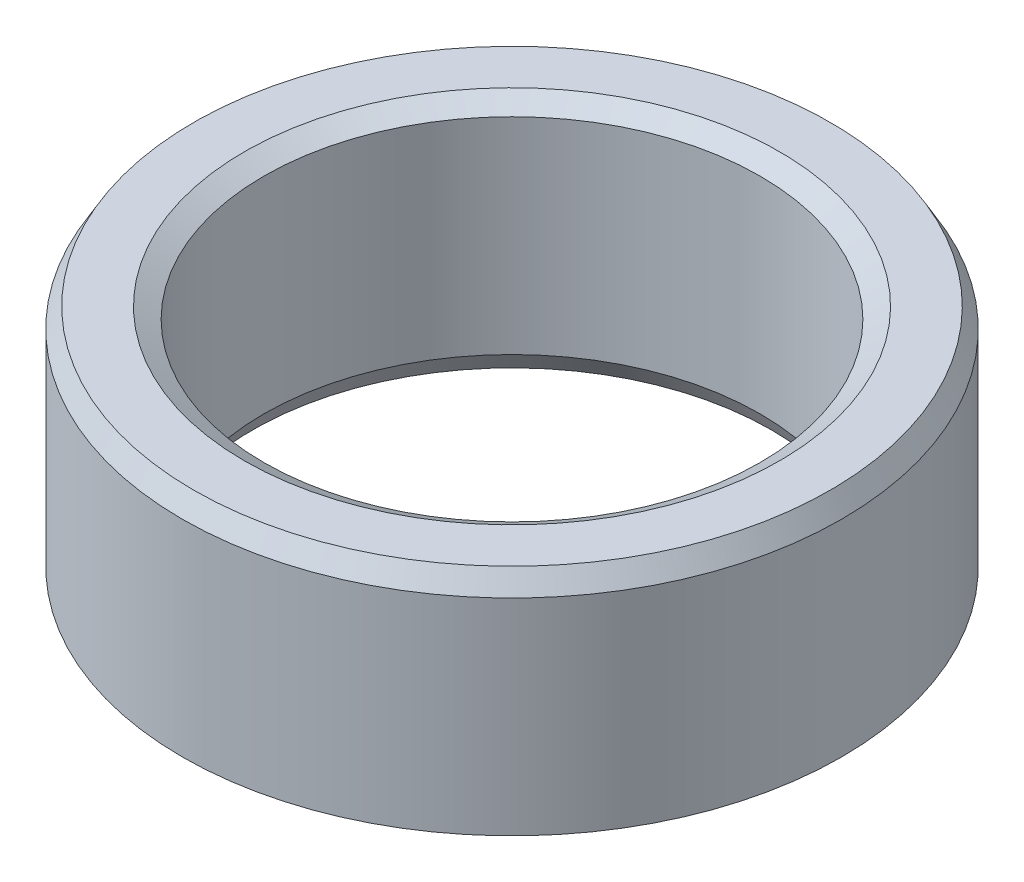
from build123d import *
from OCP.BRepFilletAPI import BRepFilletAPI_MakeChamfer

# Parameters (mm, degrees)
SKETCH1_R           = 40
BOSS_EXTRUDE1_DEPTH = 28.725931138
SKETCH2_R           = 30.10315607
CUT_EXTRUDE1_DEPTH  = 64.444299348
CHAMFER1_SIZE       = 2.372294749
CHAMFER1_SIZE2      = 1.369645012


with BuildPart() as part:
    # Sketch1 → Boss-Extrude1 (new body)
    with BuildSketch(Plane(origin=(0, 0, 0), x_dir=(1, 0, 0), z_dir=(0, 1, 0))):
        Circle(SKETCH1_R)
    extrude(amount=BOSS_EXTRUDE1_DEPTH)

    # Sketch2 → Cut-Extrude1 (cut, through all)
    with BuildSketch(Plane(origin=(0, 0, 0), x_dir=(1, 0, 0), z_dir=(0, 1, 0))):
        Circle(SKETCH2_R)
    extrude(amount=CUT_EXTRUDE1_DEPTH, mode=Mode.SUBTRACT)

    # Chamfer1: one chamfer whose edges measure the first distance from different faces: ONE call of the kernel's chamfer builder (chamfer() names one face for all edges)
    chamfer1_edges_1 = [part.edges().sort_by_distance(p)[0] for p in [
        (-30.10315607, 28.725931138, 0),
    ]]
    chamfer1_side_1 = [part.faces().sort_by_distance(p)[0] for p in [
        (-38.86862915, 28.725931138, 0),
    ]]
    chamfer1_edges_2 = [part.edges().sort_by_distance(p)[0] for p in [
        (-30.10315607, 0, 0),
    ]]
    chamfer1_side_2 = [part.faces().sort_by_distance(p)[0] for p in [
        (-30.10315607, 14.362965569, 0),
    ]]
    chamfer1_edges_3 = [part.edges().sort_by_distance(p)[0] for p in [
        (-40, 0, 0),
    ]]
    chamfer1_side_3 = [part.faces().sort_by_distance(p)[0] for p in [
        (-38.86862915, 0, 0),
    ]]
    chamfer1_edges_4 = [part.edges().sort_by_distance(p)[0] for p in [
        (-40, 28.725931138, 0),
    ]]
    chamfer1_side_4 = [part.faces().sort_by_distance(p)[0] for p in [
        (-40, 14.362965569, 0),
    ]]
    chamfer1 = BRepFilletAPI_MakeChamfer(part.part.solid().wrapped)
    for e in chamfer1_edges_1:
        chamfer1.Add(CHAMFER1_SIZE, CHAMFER1_SIZE2, e.wrapped, chamfer1_side_1[0].wrapped)  # the first distance lies on this face
    for e in chamfer1_edges_2:
        chamfer1.Add(CHAMFER1_SIZE, CHAMFER1_SIZE2, e.wrapped, chamfer1_side_2[0].wrapped)  # the first distance lies on this face
    for e in chamfer1_edges_3:
        chamfer1.Add(CHAMFER1_SIZE, CHAMFER1_SIZE2, e.wrapped, chamfer1_side_3[0].wrapped)  # the first distance lies on this face
    for e in chamfer1_edges_4:
        chamfer1.Add(CHAMFER1_SIZE, CHAMFER1_SIZE2, e.wrapped, chamfer1_side_4[0].wrapped)  # the first distance lies on this face
    add(Compound.cast(chamfer1.Shape()), mode=Mode.REPLACE)


solid = part.part
